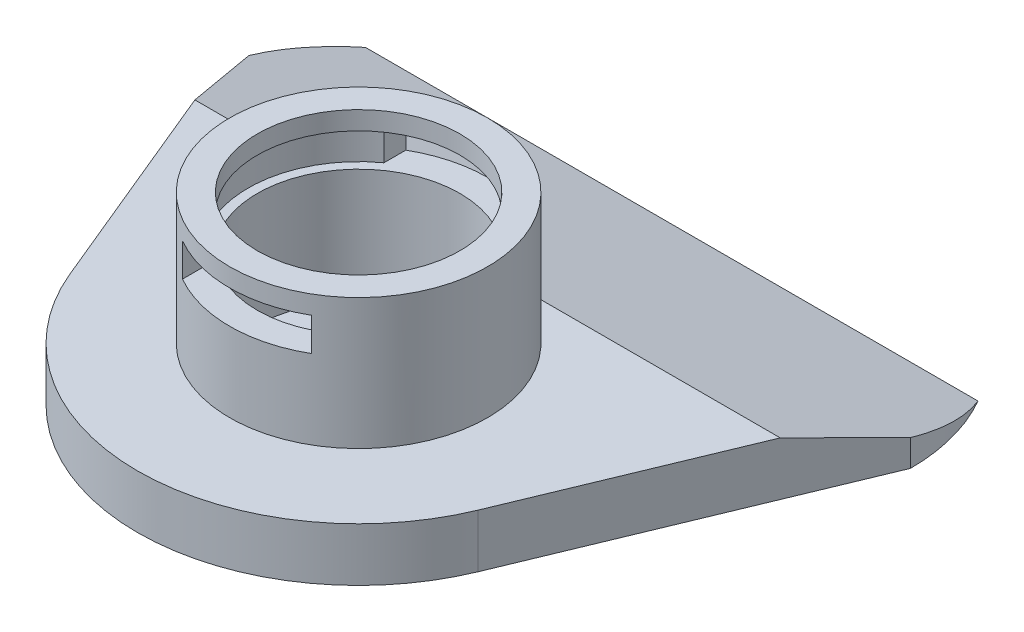
from build123d import *

# Parameters (mm, degrees)
BOSS_EXTRUDE1_DEPTH      = 2.9
SKETCH1_3_R              = 7
BOSS_EXTRUDE2_DEPTH      = 10
SKETCH7_R                = 5.5
CUT_EXTRUDE10_DEPTH      = 9
SKETCH8_R                = 6
SKETCH8_R_2              = 5.5
CUT_EXTRUDE11_DEPTH      = 1.8
CUT_EXTRUDE12_DEPTH      = 27.674619931
CUT_EXTRUDE12_DEPTH_BACK = 27.674619931
SKETCH9_W                = 7
SKETCH9_H                = 1.8
CUT_EXTRUDE13_DEPTH      = 27.674619931
CUT_EXTRUDE13_DEPTH_BACK = 27.674619931


with BuildPart() as part:
    # Sketch1 → Boss-Extrude1 (new body)
    with BuildSketch(Plane(origin=(0, 0, 0), x_dir=(1, 0, 0), z_dir=(0, 1, 0))):
        with BuildLine():
            Line((-17.959269152, 12), (-11.086554257, -4.59220151))
            ThreePointArc((-11.086554257, -4.59220151), (1.96e-07, -12), (11.086554407, -4.592201147))
            Line((11.086554407, -4.592201147), (17.959269152, 12))
            Line((17.959269152, 12), (17.959269152, 12.01))
            ThreePointArc((17.959269152, 12.01), (17.619614776, 14.59281423), (16.623747761, 17))
            Line((16.623747761, 17), (-16.623747761, 17))
            ThreePointArc((-16.623747761, 17), (-17.619614776, 14.59281423), (-17.959269152, 12.01))
            Line((-17.959269152, 12.01), (-17.959269152, 12))
        make_face()
    extrude(amount=BOSS_EXTRUDE1_DEPTH)

    # Sketch1<3> → Boss-Extrude2 (add)
    with BuildSketch(Plane(origin=(0, 0, 0), x_dir=(1, 0, 0), z_dir=(0, 1, 0))):
        Circle(SKETCH1_3_R)
    extrude(amount=BOSS_EXTRUDE2_DEPTH)

    # Sketch7 → Cut-Extrude10 (cut)
    with BuildSketch(Plane(origin=(0, 10, 0), x_dir=(1, 0, 0), z_dir=(0, 1, 0))):
        Circle(SKETCH7_R)
    extrude(amount=-CUT_EXTRUDE10_DEPTH, mode=Mode.SUBTRACT)

    # Sketch8 → Cut-Extrude11 (cut)
    with BuildSketch(Plane(origin=(0, 9, 0), x_dir=(1, 0, 0), z_dir=(0, 1, 0))):
        Circle(SKETCH8_R)
        Circle(SKETCH8_R_2, mode=Mode.SUBTRACT)
    extrude(amount=-CUT_EXTRUDE11_DEPTH, mode=Mode.SUBTRACT)

    # Sketch9 → Cut-Extrude12 (cut, two sides: drawn at the far end of the back side and taken through both)
    with BuildSketch(Plane.XY.offset(-CUT_EXTRUDE12_DEPTH_BACK)):
        with Locations((0, 8.1)):
            Rectangle(SKETCH9_W, SKETCH9_H)
    extrude(amount=CUT_EXTRUDE12_DEPTH + CUT_EXTRUDE12_DEPTH_BACK, mode=Mode.SUBTRACT)

    # Sketch10 → Cut-Extrude13 (cut, two sides: drawn at the far end of the back side and taken through both)
    with BuildSketch(Plane(origin=(0, 0, 0), x_dir=(0, 0, -1), z_dir=(1, 0, 0)).offset(-CUT_EXTRUDE13_DEPTH_BACK)):
        Polygon((17, 0), (7, 2.9), (17, 2.9), align=None)
    extrude(amount=CUT_EXTRUDE13_DEPTH + CUT_EXTRUDE13_DEPTH_BACK, mode=Mode.SUBTRACT)


solid = part.part
